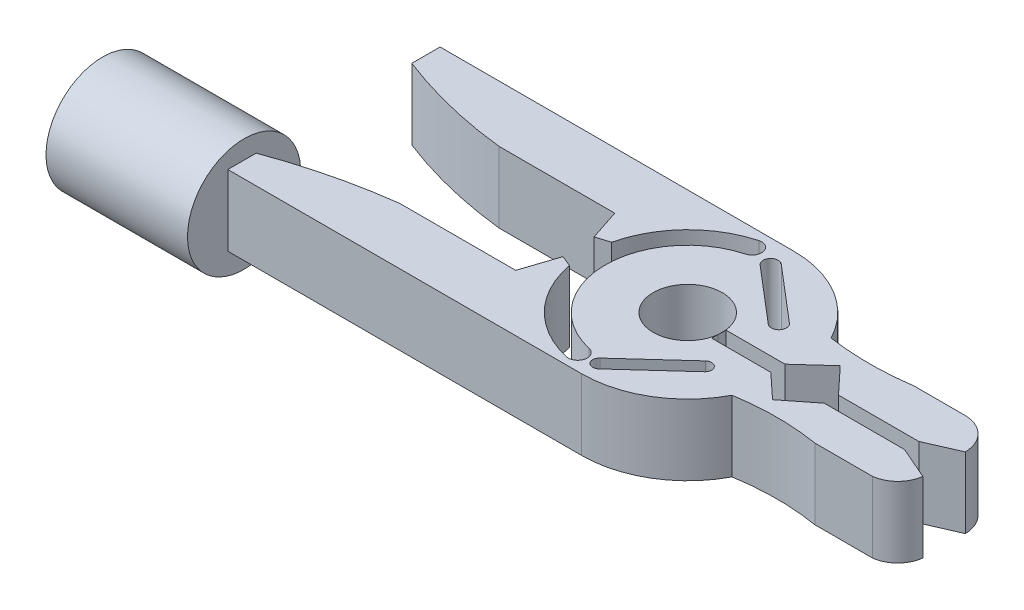
from build123d import *

# Parameters (mm, degrees)
BOSS_EXTRUDE1_DEPTH = 5
CUT_EXTRUDE1_START  = -5
CUT_EXTRUDE1_DEPTH  = 5
SKETCH3_R           = 4
BOSS_EXTRUDE2_DEPTH = 10


# Read off the part's stored shape, not the designer's step: Cut-Extrude1
with BuildPart() as part:
    # Sketch1 → Boss-Extrude1 (new body)
    with BuildSketch(Plane(origin=(0, 0, 0), x_dir=(1, 0, 0), z_dir=(0, 1, 0))):
        with BuildLine():
            Line((-6.633249581, -3.5), (-8.655407426, -3.5))
            Line((-8.655407426, -3.5), (-25, -3.5))
            Line((-25, -3.5), (-25, -7.5))
            Line((-25, -7.5), (0, -7.5))
            ThreePointArc((0, -7.5), (-3.872983346, -6.422616289), (-6.633249581, -3.5))
        make_face()
        with BuildLine():
            ThreePointArc((-6.633249581, -3.5), (-7.280088319, -1.802862744), (-7.5, 0))
            Line((-7.5, 0), (-8.655407426, -3.5))
            Line((-8.655407426, -3.5), (-6.633249581, -3.5))
        make_face()
        with BuildLine():
            Line((-8.655407426, 3.5), (-7.5, 0))
            ThreePointArc((-7.5, 0), (-7.280088319, 1.802862744), (-6.633249581, 3.5))
            Line((-6.633249581, 3.5), (-8.655407426, 3.5))
        make_face()
        with BuildLine():
            Line((-25, 3.5), (-8.655407426, 3.5))
            Line((-8.655407426, 3.5), (-6.633249581, 3.5))
            ThreePointArc((-6.633249581, 3.5), (-3.872983346, 6.422616289), (0, 7.5))
            Line((0, 7.5), (-25, 7.5))
            Line((-25, 7.5), (-25, 3.5))
        make_face()
        with BuildLine():
            ThreePointArc((0, 7.5), (-3.872983346, 6.422616289), (-6.633249581, 3.5))
            Line((-6.633249581, 3.5), (0, 3.5))
            Line((0, 3.5), (0, 7.5))
        make_face()
        with BuildLine():
            ThreePointArc((-6.633249581, 3.5), (-7.280088319, 1.802862744), (-7.5, 0))
            ThreePointArc((-7.5, 0), (-7.280088319, -1.802862744), (-6.633249581, -3.5))
            Line((-6.633249581, -3.5), (0, -3.5))
            Line((0, -3.5), (0, -7.5))
            ThreePointArc((0, -7.5), (3.872983346, -6.422616289), (6.633249581, -3.5))
            Line((6.633249581, -3.5), (5.841817388, -3.5))
            Line((5.841817388, -3.5), (5.841817388, 3.5))
            Line((5.841817388, 3.5), (6.633249581, 3.5))
            ThreePointArc((6.633249581, 3.5), (3.872983346, 6.422616289), (0, 7.5))
            Line((0, 7.5), (0, 3.5))
            Line((0, 3.5), (-6.633249581, 3.5))
        make_face()
        with BuildLine():
            Line((0, -3.5), (-6.633249581, -3.5))
            ThreePointArc((-6.633249581, -3.5), (-3.872983346, -6.422616289), (0, -7.5))
            Line((0, -7.5), (0, -3.5))
        make_face()
        with BuildLine():
            Line((5.841817388, -3.5), (6.633249581, -3.5))
            ThreePointArc((6.633249581, -3.5), (7.280088319, -1.802862744), (7.5, 0))
            ThreePointArc((7.5, 0), (7.280088319, 1.802862744), (6.633249581, 3.5))
            Line((6.633249581, 3.5), (5.841817388, 3.5))
            Line((5.841817388, 3.5), (5.841817388, -3.5))
        make_face()
        with BuildLine():
            ThreePointArc((7.5, 0), (7.280088319, -1.802862744), (6.633249581, -3.5))
            Line((6.633249581, -3.5), (18.341817388, -3.5))
            Line((18.341817388, -3.5), (18.341817388, 3.5))
            Line((18.341817388, 3.5), (6.633249581, 3.5))
            ThreePointArc((6.633249581, 3.5), (7.280088319, 1.802862744), (7.5, 0))
        make_face()
    extrude(amount=BOSS_EXTRUDE1_DEPTH)

    # Cut-Extrude1 outline → Cut-Extrude1 (cut)
    with BuildSketch(Plane(origin=(0, 5, 0), x_dir=(1, 0, 0), z_dir=(0, 1, 0)).offset(CUT_EXTRUDE1_START)):
        with BuildLine():
            ThreePointArc((-25, -5.5), (-20.971570556, -4.264152844), (-16.827703713, -3.5))
            Line((-16.827703713, -3.5), (-25, -3.5))
            Line((-25, -3.5), (-25, -5.5))
        make_face()
        with BuildLine():
            Line((-6.986211906, 1.605049615), (-7.936290273, 1.321625532))
            Line((-7.936290273, 1.321625532), (-7.5, 0))
            Line((-7.5, 0), (-7.82594424, -0.987361527))
            Line((-7.82594424, -0.987361527), (-7.04751698, -1.309902849))
            ThreePointArc((-7.04751698, -1.309902849), (-5.16604089, -4.969442885), (-1.582216118, -6.991418541))
            ThreePointArc((-1.582216118, -6.991418541), (-0.778502232, -6.484346421), (-1.285574352, -5.680632535))
            ThreePointArc((-1.285574352, -5.680632535), (-5.822856725, -0.128945605), (-1.535782965, 5.618154331))
            ThreePointArc((-1.535782965, 5.618154331), (-1.064786538, 6.443527284), (-1.890159491, 6.914523712))
            ThreePointArc((-1.890159491, 6.914523712), (-5.171568533, 4.963690156), (-6.986211906, 1.605049615))
        make_face()
        with BuildLine():
            ThreePointArc((-16.827703713, 3.5), (-20.979738657, 4.230776773), (-25, 5.5))
            Line((-25, 5.5), (-25, 3.5))
            Line((-25, 3.5), (-16.827703713, 3.5))
        make_face()
        with BuildLine():
            Line((2.423046834, -0.273137336), (2.423046834, 0.273137336))
            ThreePointArc((2.423046834, 0.273137336), (-2.438392906, 0), (2.423046834, -0.273137336))
        make_face()
        with BuildLine():
            ThreePointArc((6.633249581, 3.5), (9.560391533, 3.285101605), (12.487533484, 3.5))
            Line((12.487533484, 3.5), (6.633249581, 3.5))
        make_face()
        with BuildLine():
            ThreePointArc((16.114954724, 3.5), (17.680951034, 2.839133646), (18.341817388, 1.273137336))
            Line((18.341817388, 1.273137336), (18.341817388, 3.5))
            Line((18.341817388, 3.5), (16.114954724, 3.5))
        make_face()
        with BuildLine():
            Line((6.633249581, -3.5), (12.487533484, -3.5))
            ThreePointArc((12.487533484, -3.5), (9.560391532, -3.257612869), (6.633249581, -3.5))
        make_face()
        with BuildLine():
            Line((18.341817388, -3.5), (18.341817388, -1.726862664))
            ThreePointArc((18.341817388, -1.726862664), (17.758698799, -2.916881411), (16.568680051, -3.5))
            Line((16.568680051, -3.5), (18.341817388, -3.5))
        make_face()
        with BuildLine():
            Line((6.599609394, 0.273137336), (2.423046834, 0.273137336))
            ThreePointArc((2.423046834, 0.273137336), (2.438392906, 0), (2.423046834, -0.273137336))
            Line((2.423046834, -0.273137336), (2.423046834, -0.726862664))
            Line((2.423046834, -0.726862664), (6.599609394, -0.726862664))
            Line((6.599609394, -0.726862664), (8.33499846, -2.338830502))
            Line((8.33499846, -2.338830502), (10.382432111, -0.726862664))
            Line((10.382432111, -0.726862664), (16.055042397, -0.726862664))
            Line((16.055042397, -0.726862664), (18.341817388, -1.726862664))
            Line((18.341817388, -1.726862664), (18.341817388, 1.273137336))
            Line((18.341817388, 1.273137336), (16.055042397, 0.273137336))
            Line((16.055042397, 0.273137336), (10.382432111, 0.273137336))
            Line((10.382432111, 0.273137336), (8.647043044, 2.132151084))
            Line((8.647043044, 2.132151084), (6.599609394, 0.273137336))
        make_face()
        with BuildLine():
            ThreePointArc((0.343811413, 6.266339021), (-0.403495587, 6.206654847), (-0.343811413, 5.459347847))
            Line((-0.343811413, 5.459347847), (3.560972322, 2.132151084))
            ThreePointArc((3.560972322, 2.132151084), (4.308279322, 2.191835258), (4.248595147, 2.939142258))
            Line((4.248595147, 2.939142258), (0.343811413, 6.266339021))
        make_face()
        with BuildLine():
            ThreePointArc((4.222069016, -3.035690029), (4.253213498, -2.369974984), (3.587498453, -2.338830502))
            Line((3.587498453, -2.338830502), (-0.317285282, -5.894584161))
            ThreePointArc((-0.317285282, -5.894584161), (-0.348429764, -6.560299207), (0.317285282, -6.591443689))
            Line((0.317285282, -6.591443689), (4.222069016, -3.035690029))
        make_face()
    extrude(amount=CUT_EXTRUDE1_DEPTH, mode=Mode.SUBTRACT)

    # Sketch3 → Boss-Extrude2 (add)
    with BuildSketch(Plane.ZY.offset(25)):
        with Locations((6.35032425, 2.312951567)):
            Circle(SKETCH3_R)
    extrude(amount=BOSS_EXTRUDE2_DEPTH)


solid = part.part
